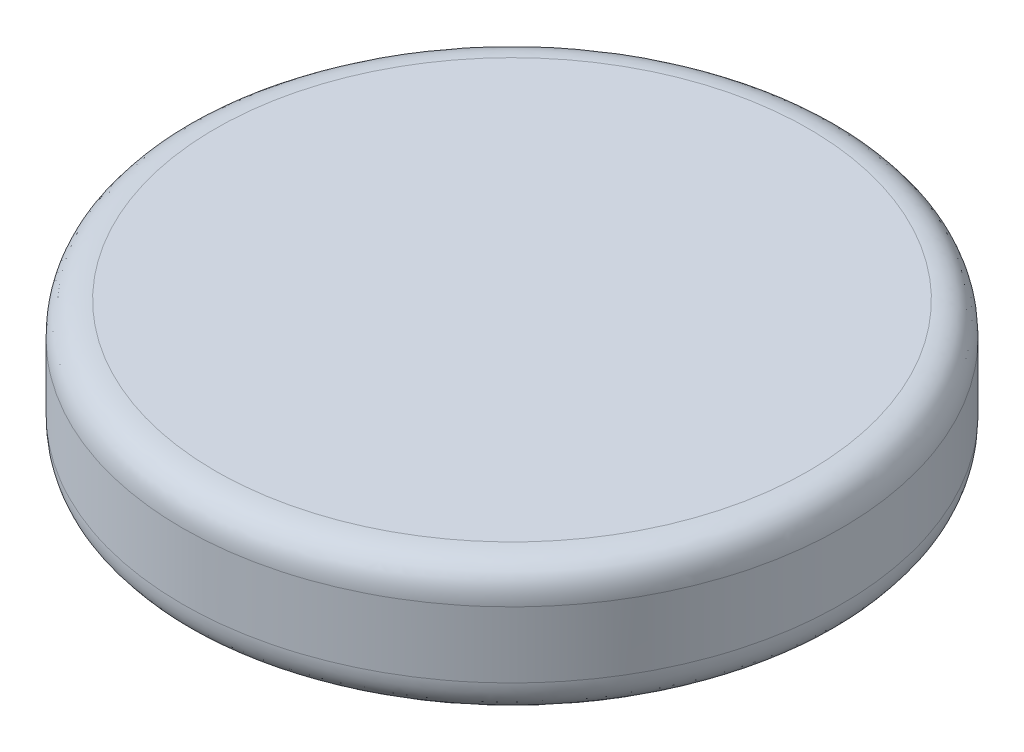
from build123d import *

# Parameters (mm, degrees)
SKETCH1_R           = 100
BOSS_EXTRUDE1_DEPTH = 40
SKETCH2_R           = 15
CUT_EXTRUDE1_DEPTH  = 7
FILLET2_SIZE        = 10


with BuildPart() as part:
    # Sketch1 → Boss-Extrude1 (new body)
    with BuildSketch(Plane(origin=(0, 0, 0), x_dir=(1, 0, 0), z_dir=(0, 1, 0))):
        with Locations(Location((0, 0, 0), (0, 0, 270))):
            Circle(SKETCH1_R)
    extrude(amount=BOSS_EXTRUDE1_DEPTH)

    # Sketch2 → Cut-Extrude1 (cut)
    with BuildSketch(Plane.XZ):
        with Locations(Location((0, 0, 0), (0, 0, 270))):
            Circle(SKETCH2_R)
    extrude(amount=-CUT_EXTRUDE1_DEPTH, mode=Mode.SUBTRACT)

    # Fillet2
    # a fillet whose section is not a circle: 10 mm, written as the material it takes off along each edge
    with BuildSketch(Plane(origin=(0, 0, 0), x_dir=(0, 0, 1), z_dir=(-1, 0, 0))) as fillet2_piece_1:
        with BuildLine():
            Bezier((100, FILLET2_SIZE), (100, 0), (100 - FILLET2_SIZE, 0), weights=[1, 1, 1])
            Line((100 - FILLET2_SIZE, 0), (100, 0))
            Line((100, 0), (100, FILLET2_SIZE))
        make_face()
    revolve(axis=Axis((0, 0, 0), (0, 1, 0)), mode=Mode.SUBTRACT)
    with BuildSketch(Plane(origin=(0, 40, 0), x_dir=(0, 0, 1), z_dir=(-1, 0, 0))) as fillet2_piece_2:
        with BuildLine():
            Bezier((100, -FILLET2_SIZE), (100, 0), (100 - FILLET2_SIZE, 0), weights=[1, 1, 1])
            Line((100 - FILLET2_SIZE, 0), (100, 0))
            Line((100, 0), (100, -FILLET2_SIZE))
        make_face()
    revolve(axis=Axis((0, 40, 0), (0, 1, 0)), mode=Mode.SUBTRACT)


solid = part.part
